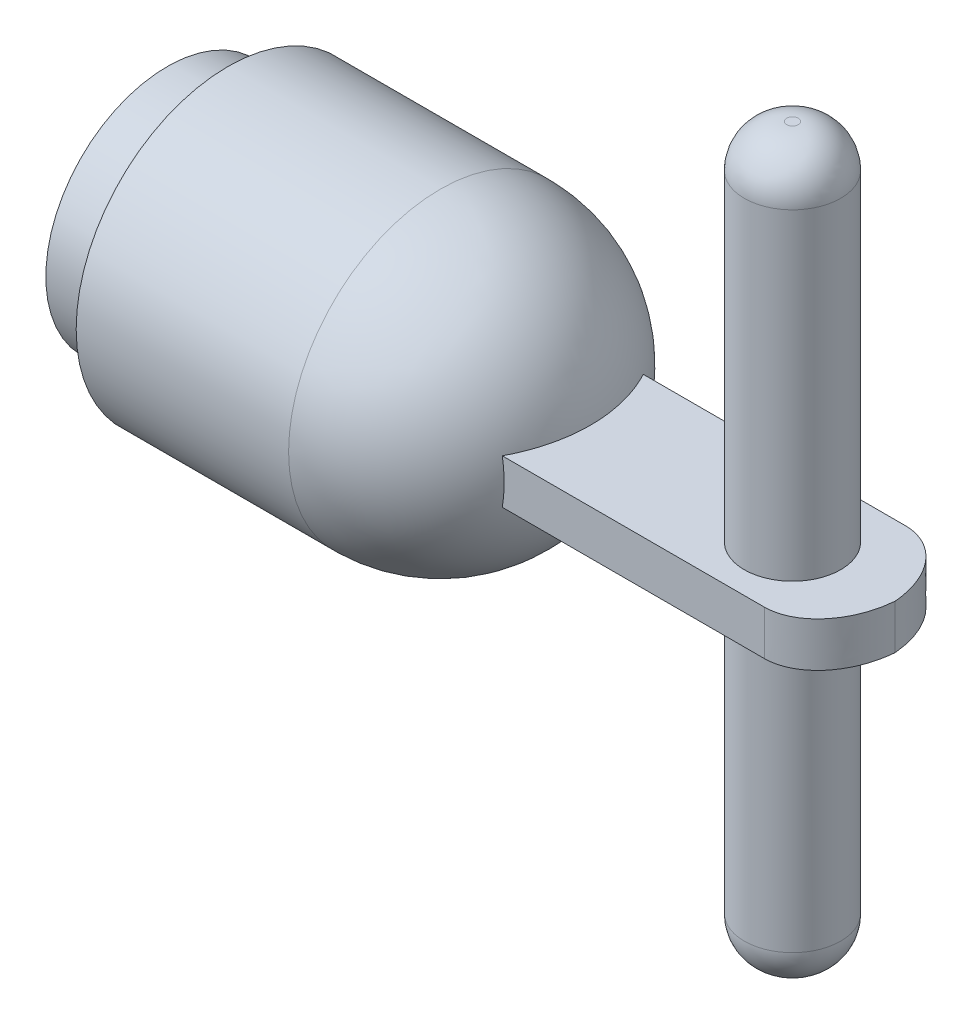
from build123d import *

# Parameters (mm, degrees)
SKETCH1_R           = 20
BOSS_EXTRUDE1_DEPTH = 10
SKETCH2_R           = 25
BOSS_EXTRUDE2_DEPTH = 60
FILLET1_R           = 25
SKETCH3_W           = 23.240720894
SKETCH3_H           = 7.34315937
BOSS_EXTRUDE3_DEPTH = 120
SKETCH4_R           = 7.943437771
BOSS_EXTRUDE4_DEPTH = 60
FILLET2_R           = 7
FILLET3_R           = 7
FILLET4_SIZE        = 10
FILLET4_SIZE_2      = 13


with BuildPart() as part:
    # Sketch1 → Boss-Extrude1 (new body)
    with BuildSketch(Plane(origin=(0, 0, 0), x_dir=(0, 0, -1), z_dir=(1, 0, 0))):
        Circle(SKETCH1_R)
    extrude(amount=BOSS_EXTRUDE1_DEPTH)

    # Sketch2 → Boss-Extrude2 (add)
    with BuildSketch(Plane(origin=(10, 0, 0), x_dir=(0, 0, -1), z_dir=(1, 0, 0))):
        Circle(SKETCH2_R)
    extrude(amount=BOSS_EXTRUDE2_DEPTH)

    # Fillet1
    fillet1_edges = [part.edges().sort_by_distance(p)[0] for p in [
        (70, 0, 25),
    ]]
    fillet(fillet1_edges, radius=FILLET1_R)

    # Sketch3 → Boss-Extrude3 (add)
    with BuildSketch(Plane.ZY):
        Rectangle(SKETCH3_W, SKETCH3_H)
    extrude(amount=-BOSS_EXTRUDE3_DEPTH)

    # Sketch4 → Boss-Extrude4 (add, symmetric)
    with BuildSketch(Plane(origin=(0, 3.671579685, 0), x_dir=(1, 0, 0), z_dir=(0, 1, 0))):
        with Locations(Location((103.030776269, 0, 0), (0, 0, 270))):
            Circle(SKETCH4_R)
    extrude(amount=BOSS_EXTRUDE4_DEPTH, both=True)

    # Fillet2
    fillet2_edges = [part.edges().sort_by_distance(p)[0] for p in [
        (103.030776269, 63.671579685, -7.943437771),
    ]]
    fillet(fillet2_edges, radius=FILLET2_R)

    # Fillet3
    fillet3_edges = [part.edges().sort_by_distance(p)[0] for p in [
        (103.030776269, -56.328420315, -7.943437771),
    ]]
    fillet(fillet3_edges, radius=FILLET3_R)

    # Fillet4
    # an asymmetric fillet: 13, 10 mm, written as the material it takes off along each edge
    with BuildSketch(Plane(origin=(120, -36.171579685, -11.620360447), x_dir=(-1, 0, 0), z_dir=(0, 1, 0)), Plane(origin=(120, 36.171579685, 11.620360447), x_dir=(-1, 0, 0), z_dir=(0, -1, 0))) as fillet4_piece_1:
        with BuildLine():
            Bezier((FILLET4_SIZE, 0), (0, 0), (0, FILLET4_SIZE_2), weights=[1, 0.707106781, 1])
            Line((0, FILLET4_SIZE_2), (0, 0))
            Line((0, 0), (FILLET4_SIZE, 0))
        make_face()
    extrude(amount=72.34315937, mode=Mode.SUBTRACT)


solid = part.part
